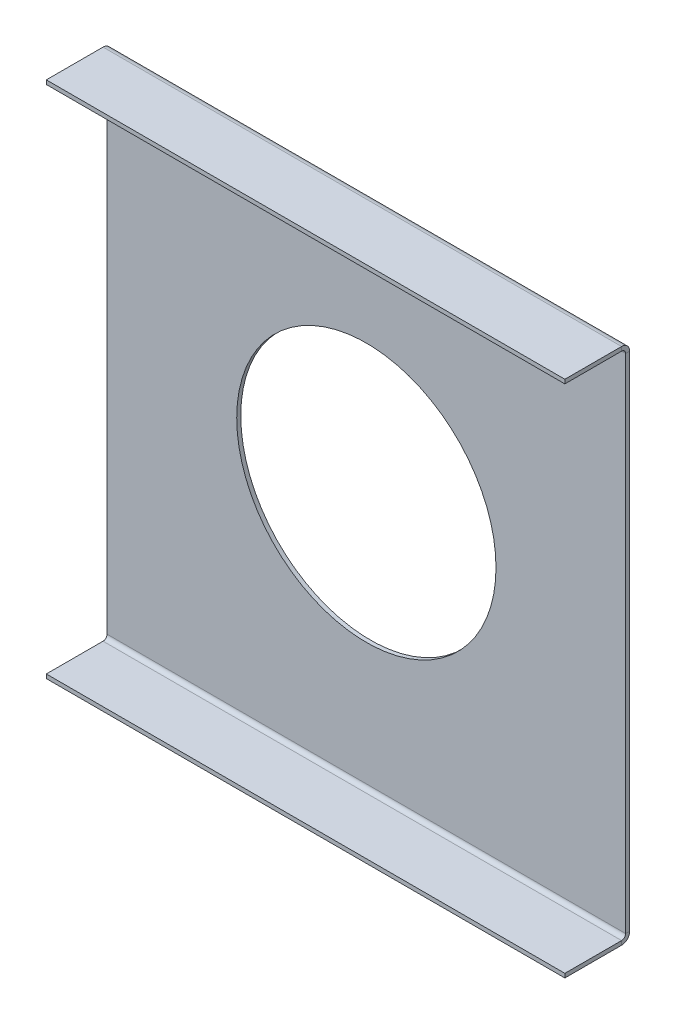
from build123d import *

# Parameters (mm, degrees)
SKETCH1_W                      = 203.2
SKETCH1_H                      = 203.2
BOSS_EXTRUDE2_DEPTH            = 1.5875
EDGE_FLANGE1_STRIP_W           = 9.525
EDGE_FLANGE1_STRIP_H           = 1.5875
EDGE_FLANGE1_STRIP_CUT_DEPTH   = 203.2
EDGE_FLANGE1_STRIP_2_W         = 9.525
EDGE_FLANGE1_STRIP_2_H         = 1.5875
EDGE_FLANGE1_STRIP_CUT_2_DEPTH = 203.2
EDGE_FLANGE1_DEPTH             = 203.2
EDGE_FLANGE1_BEND_DEPTH        = 203.2
SKETCH16_R                     = 50.8
CUT_EXTRUDE1_DEPTH             = 2.54


# Sheet-metal steps are written as plain solids
with BuildPart() as part:
    # Sketch1 → Boss-Extrude2 (new body)
    with BuildSketch(Plane.XY):
        with Locations((101.6, 101.6)):
            Rectangle(SKETCH1_W, SKETCH1_H)
    extrude(amount=BOSS_EXTRUDE2_DEPTH)

    # Edge-Flange1 strip (across the edge) → Edge-Flange1 strip cut (cut)
    with BuildSketch(Plane(origin=(203.2, 203.2, 1.5875), x_dir=(0, -1, 0), z_dir=(-1, 0, 0))):
        with Locations((-1.5875, -0.79375)):
            Rectangle(EDGE_FLANGE1_STRIP_W, EDGE_FLANGE1_STRIP_H)
    extrude(amount=EDGE_FLANGE1_STRIP_CUT_DEPTH, mode=Mode.SUBTRACT)

    # Edge-Flange1 strip 2 (across the edge) → Edge-Flange1 strip cut 2 (cut)
    with BuildSketch(Plane(origin=(0, 0, 1.5875), x_dir=(0, 1, 0), z_dir=(1, 0, 0))):
        with Locations((-1.5875, -0.79375)):
            Rectangle(EDGE_FLANGE1_STRIP_2_W, EDGE_FLANGE1_STRIP_2_H)
    extrude(amount=EDGE_FLANGE1_STRIP_CUT_2_DEPTH, mode=Mode.SUBTRACT)

    # Edge-Flange1 section (across the edge) → Edge-Flange1 (add)
    with BuildSketch(Plane(origin=(203.2, 203.2, 1.5875), x_dir=(0, -1, 0), z_dir=(-1, 0, 0))):
        with BuildLine():
            Line((0, 1.5875), (0, 23.8125))
            Line((0, 23.8125), (1.5875, 23.8125))
            Line((1.5875, 23.8125), (1.5875, 1.5875))
            ThreePointArc((1.5875, 1.5875), (2.052467985, 0.464967985), (3.175, 0))
            Line((3.175, 0), (3.175, -1.5875))
            ThreePointArc((3.175, -1.5875), (0.92993597, -0.65756403), (0, 1.5875))
        make_face()
    extrude(amount=EDGE_FLANGE1_DEPTH)

    # Edge-Flange1 section 2 (across the edge) → Edge-Flange1 bend (add)
    with BuildSketch(Plane(origin=(0, 0, 1.5875), x_dir=(0, 1, 0), z_dir=(1, 0, 0))):
        with BuildLine():
            Line((0, 1.5875), (0, 23.8125))
            Line((0, 23.8125), (1.5875, 23.8125))
            Line((1.5875, 23.8125), (1.5875, 1.5875))
            ThreePointArc((1.5875, 1.5875), (2.052467985, 0.464967985), (3.175, 0))
            Line((3.175, 0), (3.175, -1.5875))
            ThreePointArc((3.175, -1.5875), (0.92993597, -0.65756403), (0, 1.5875))
        make_face()
    extrude(amount=EDGE_FLANGE1_BEND_DEPTH)

    # Sketch16 → Cut-Extrude1 (cut)
    with BuildSketch(Plane(origin=(0, 0, 0), x_dir=(-1, 0, 0), z_dir=(0, 0, -1))):
        with Locations((-101.6, 101.975799724)):
            Circle(SKETCH16_R)
    extrude(amount=-CUT_EXTRUDE1_DEPTH, mode=Mode.SUBTRACT)


solid = part.part
